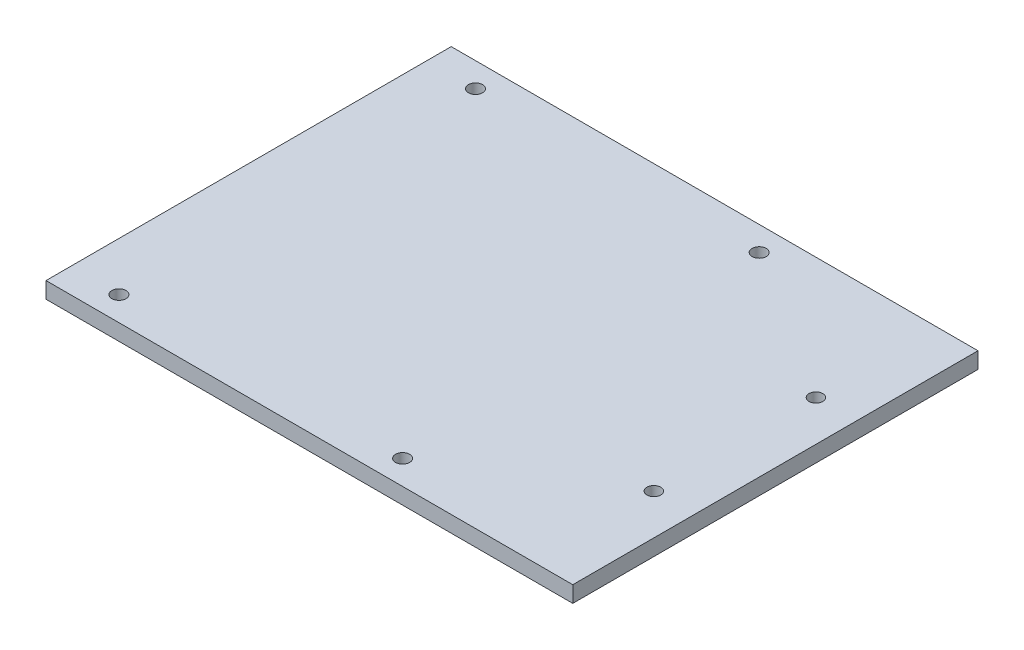
from build123d import *

# Parameters (mm, degrees)
SKETCH1_W           = 130
SKETCH1_H           = 100
BOSS_EXTRUDE1_DEPTH = 4
SKETCH4_R           = 1.7
CUT_EXTRUDE1_DEPTH  = 165.060964279
BOSS_EXTRUDE2_DEPTH = 16
SKETCH7_R           = 1.75
CUT_EXTRUDE2_DEPTH  = 166.227116419


with BuildPart() as part:
    # Sketch1 → Boss-Extrude1 (new body)
    with BuildSketch(Plane(origin=(0, 0, 0), x_dir=(1, 0, 0), z_dir=(0, 1, 0))):
        with Locations((65, 50)):
            Rectangle(SKETCH1_W, SKETCH1_H)
    extrude(amount=BOSS_EXTRUDE1_DEPTH)

    # Sketch4 → Cut-Extrude1 (cut, through all)
    with BuildSketch(Plane(origin=(0, 4, 0), x_dir=(1, 0, 0), z_dir=(0, 1, 0))):
        with Locations((120, 30)):
            Circle(SKETCH4_R)
        with Locations((120, 70)):
            Circle(SKETCH4_R)
    extrude(amount=-CUT_EXTRUDE1_DEPTH, mode=Mode.SUBTRACT)

    # Sketch6 → Boss-Extrude2 (add)
    with BuildSketch(Plane.XZ):
        Polygon((50, -50), (37.5, -28.349364905), (12.5, -28.349364905), (0, -50), (12.5, -71.650635095), (37.5, -71.650635095), align=None)
    extrude(amount=BOSS_EXTRUDE2_DEPTH)

    # Sketch7 → Cut-Extrude2 (cut, through all)
    with BuildSketch(Plane(origin=(0, 4, 0), x_dir=(1, 0, 0), z_dir=(0, 1, 0))):
        with Locations((12, 6)):
            Circle(SKETCH7_R)
        with Locations((82, 6)):
            Circle(SKETCH7_R)
        with Locations((82, 94)):
            Circle(SKETCH7_R)
        with Locations((12, 94)):
            Circle(SKETCH7_R)
    extrude(amount=-CUT_EXTRUDE2_DEPTH, mode=Mode.SUBTRACT)


solid = part.part
